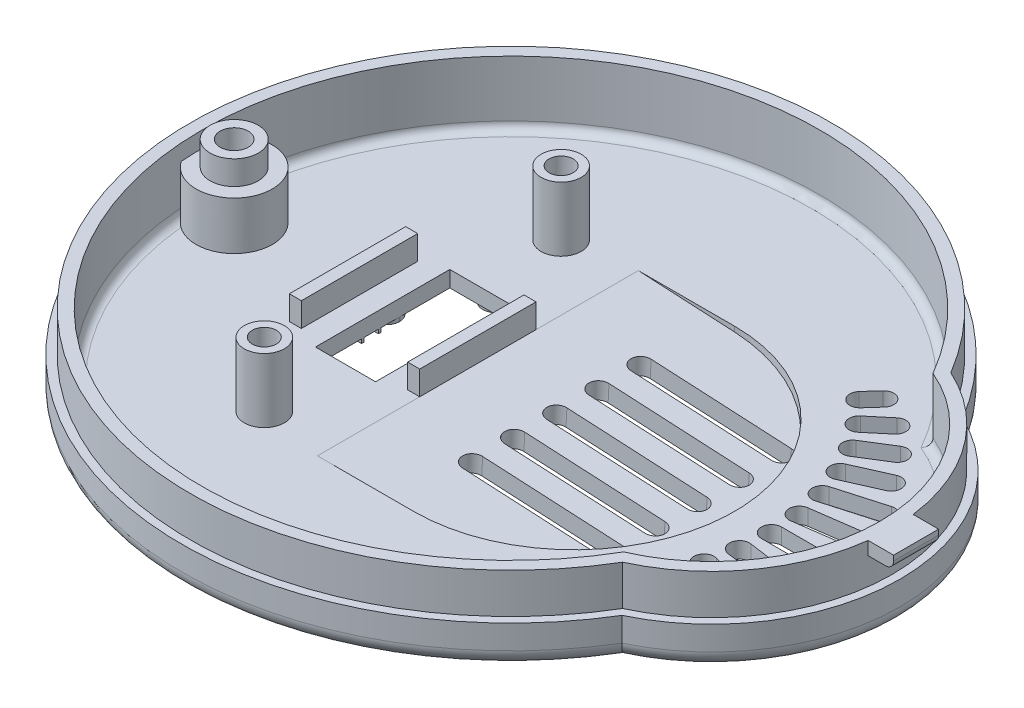
from build123d import *

# Parameters (mm, degrees)
BOSS_EXTRUDE3_DEPTH        = 2
BOSS_EXTRUDE4_DEPTH        = 10
BOSS_EXTRUDE5_DEPTH        = 5
BOSS_EXTRUDE7_START        = -1.65
BOSS_EXTRUDE7_DEPTH        = 1.65
FILLET2_R                  = 1
SKETCH12_W                 = 7.5
SKETCH12_H                 = 16.75
CUT_EXTRUDE1_DEPTH         = 2
SKETCH17_W                 = 1.5
SKETCH17_H                 = 14.5
BOSS_EXTRUDE8_DEPTH        = 3
SKETCH18_R                 = 2.5
SKETCH18_R_2               = 1.5
BOSS_EXTRUDE9_DEPTH        = 8
FILLET3_R                  = 2
FILLET4_R                  = 1
SKETCH20_R                 = 4.75
BOSS_EXTRUDE10_DEPTH       = 6
SKETCH19_R                 = 4
CUT_EXTRUDE2_DEPTH         = 5
SKETCH21_R                 = 3
BOSS_EXTRUDE11_DEPTH       = 3
CUT_EXTRUDE3_DEPTH         = 66.971584871
CUT_EXTRUDE3_DEPTH_BACK    = 66.971584871
SKETCH22_R                 = 1.75
BOSS_EXTRUDE12_OUTLINE_R   = 1.6742555
BOSS_EXTRUDE12_OUTLINE_R_2 = 1.275330366
BOSS_EXTRUDE12_OUTLINE_R_3 = 1.309435817
BOSS_EXTRUDE12_OUTLINE_W   = 3.190146264
BOSS_EXTRUDE12_OUTLINE_H   = 0.307258176
BOSS_EXTRUDE12_DEPTH       = 0.5
BOSS_EXTRUDE13_DEPTH       = 0.5
CUT_REVOLVE1_ANGLE         = 3
REVOLVE1_ANGLE             = 3
CUT_EXTRUDE4_DEPTH         = 67.049620842
FILLET5_R                  = 0.3
CUT_EXTRUDE5_DEPTH         = 66.971584854


# Read off the part's stored shape, not the designer's step: Boss-Extrude12
with BuildPart() as part:
    # Sketch4 → Boss-Extrude3 (new body)
    with BuildSketch(Plane(origin=(0, 0, 0), x_dir=(1, 0, 0), z_dir=(0, 1, 0))):
        with BuildLine():
            ThreePointArc((35.075, 21.230741273), (-41, 0), (35.075, -21.230741273))
            ThreePointArc((35.075, -21.230741273), (48.5, 0), (35.075, 21.230741273))
        make_face()
    extrude(amount=BOSS_EXTRUDE3_DEPTH)

    # Sketch4<5> → Boss-Extrude4 (add)
    with BuildSketch(Plane(origin=(0, 0, 0), x_dir=(1, 0, 0), z_dir=(0, 1, 0))):
        with BuildLine():
            ThreePointArc((34.375, 20.453835215), (-40, 0), (34.375, -20.453835215))
            ThreePointArc((34.375, -20.453835215), (47.5, 0), (34.375, 20.453835215))
        make_face()
        with BuildLine():
            ThreePointArc((33.325, -19.279376935), (46, 0), (33.325, 19.279376935))
            ThreePointArc((33.325, 19.279376935), (-38.5, 0), (33.325, -19.279376935))
        make_face(mode=Mode.SUBTRACT)
    extrude(amount=BOSS_EXTRUDE4_DEPTH)

    # Sketch4<6> → Boss-Extrude5 (add)
    with BuildSketch(Plane(origin=(0, 0, 0), x_dir=(1, 0, 0), z_dir=(0, 1, 0))):
        with BuildLine():
            ThreePointArc((35.075, 21.230741273), (-41, 0), (35.075, -21.230741273))
            ThreePointArc((35.075, -21.230741273), (48.5, 0), (35.075, 21.230741273))
        make_face()
        with BuildLine():
            ThreePointArc((34.375, -20.453835215), (47.5, 0), (34.375, 20.453835215))
            ThreePointArc((34.375, 20.453835215), (-40, 0), (34.375, -20.453835215))
        make_face(mode=Mode.SUBTRACT)
    extrude(amount=BOSS_EXTRUDE5_DEPTH)

    # Sketch11 → Boss-Extrude7 (add)
    with BuildSketch(Plane(origin=(0, 10, 0), x_dir=(1, 0, 0), z_dir=(0, 1, 0)).offset(BOSS_EXTRUDE7_START)):
        with BuildLine():
            ThreePointArc((47.324336307, 2.806066364), (47.5, 0), (47.324336307, -2.806066364))
            Line((47.324336307, -2.806066364), (50.5, -2.806066364))
            Line((50.5, -2.806066364), (50.5, 2.806066364))
            Line((50.5, 2.806066364), (47.324336307, 2.806066364))
        make_face()
    extrude(amount=BOSS_EXTRUDE7_DEPTH)

    # Fillet2
    fillet2_edges = [part.edges().sort_by_distance(p)[0] for p in [
        (50.5, 8.35, 0),
    ]]
    fillet(fillet2_edges, radius=FILLET2_R)

    # Sketch12 → Cut-Extrude1 (cut)
    with BuildSketch(Plane.XZ):
        with Locations((-12.25, 0)):
            Rectangle(SKETCH12_W, SKETCH12_H)
    extrude(amount=-CUT_EXTRUDE1_DEPTH, mode=Mode.SUBTRACT)

    # Sketch17 → Boss-Extrude8 (add)
    with BuildSketch(Plane(origin=(0, 2, 0), x_dir=(1, 0, 0), z_dir=(0, 1, 0))):
        Polygon((-5.625, 0), (-5.625, -7.25), (-4.125, -7.25), (-4.125, 7.25), (-5.625, 7.25), align=None)
        with Locations((-19.625, 0)):
            Rectangle(SKETCH17_W, SKETCH17_H)
    extrude(amount=BOSS_EXTRUDE8_DEPTH)

    # Sketch18 → Boss-Extrude9 (add)
    # profile 1 of 2: a face of its own
    with BuildSketch(Plane(origin=(0, 2, 0), x_dir=(1, 0, 0), z_dir=(0, 1, 0))):
        with Locations(Location((-12.25, -18.5, 0), (0, 0, 270))):
            Circle(SKETCH18_R)
        with Locations(Location((-12.25, -18.5, 0), (0, 0, 270))):
            Circle(SKETCH18_R_2, mode=Mode.SUBTRACT)
    # profile 2 of 2: a face of its own
    with BuildSketch(Plane(origin=(0, 2, 0), x_dir=(1, 0, 0), z_dir=(0, 1, 0))):
        with Locations(Location((-12.25, 18.5, 0), (0, 0, 270))):
            Circle(SKETCH18_R)
        with Locations(Location((-12.25, 18.5, 0), (0, 0, 270))):
            Circle(SKETCH18_R_2, mode=Mode.SUBTRACT)
    extrude(amount=BOSS_EXTRUDE9_DEPTH)

    # Fillet3
    fillet3_edges = [part.edges().sort_by_distance(p)[0] for p in [
        (48.5, 0, 0),
        (-41, 0, 0),
    ]]
    fillet(fillet3_edges, radius=FILLET3_R)

    # Fillet4
    fillet4_edges = [part.edges().sort_by_distance(p)[0] for p in [
        (46, 2, 0),
        (-38.5, 2, 0),
    ]]
    fillet(fillet4_edges, radius=FILLET4_R)

    # Sketch20 → Boss-Extrude10 (add)
    with BuildSketch(Plane(origin=(0, 2, 0), x_dir=(1, 0, 0), z_dir=(0, 1, 0))):
        with Locations((-34.5, 0)):
            Circle(SKETCH20_R)
    extrude(amount=BOSS_EXTRUDE10_DEPTH)

    # Sketch19 → Cut-Extrude2 (cut)
    with BuildSketch(Plane.XZ):
        with Locations(Location((-34.5, 0, 0), (0, 0, 270))):
            Circle(SKETCH19_R)
    extrude(amount=-CUT_EXTRUDE2_DEPTH, mode=Mode.SUBTRACT)

    # Sketch21 → Boss-Extrude11 (add)
    with BuildSketch(Plane(origin=(0, 8, 0), x_dir=(1, 0, 0), z_dir=(0, 1, 0))):
        with Locations(Location((-34.5, 0, 0), (0, 0, 270))):
            Circle(SKETCH21_R)
    extrude(amount=BOSS_EXTRUDE11_DEPTH)

    # Sketch22 → Cut-Extrude3 (cut, two sides: drawn at the far end of the back side and taken through both)
    with BuildSketch(Plane(origin=(0, 11, 0), x_dir=(1, 0, 0), z_dir=(0, 1, 0)).offset(-CUT_EXTRUDE3_DEPTH_BACK)):
        with Locations(Location((-34.5, 0, 0), (0, 0, 270))):
            Circle(SKETCH22_R)
    extrude(amount=CUT_EXTRUDE3_DEPTH + CUT_EXTRUDE3_DEPTH_BACK, mode=Mode.SUBTRACT)

    # Boss-Extrude12 outline → Boss-Extrude12 (add)
    # profile 1 of 7: a face of its own
    with BuildSketch(Plane.XZ):
        with Locations((-12.125287321, -10.272169908)):
            Circle(BOSS_EXTRUDE12_OUTLINE_R)
        with Locations((-12.125287321, -10.272169908)):
            Circle(BOSS_EXTRUDE12_OUTLINE_R_2, mode=Mode.SUBTRACT)
    # profile 2 of 7: a face of its own
    with BuildSketch(Plane.XZ):
        Polygon((-17.578397289, 0.525371169), (-17.578397289, 1.743381476), (-17.834807781, 1.743381476), (-17.834807781, 0.525371169), (-18.844865109, 0.525371169), (-18.844865109, 1.743381476), (-19.156794578, 1.743381476), (-19.156794578, 0.228295484), (-16, 0.228295484), (-16, 0.525371169), align=None)
    # profile 3 of 7: a face of its own
    with BuildSketch(Plane.XZ):
        Polygon((-19.156794578, 2.322679061), (-16, 2.322679061), (-16, 2.63460853), (-17.578397289, 2.63460853), (-17.578397289, 3.912033974), (-17.834807781, 3.912033974), (-17.834807781, 2.63460853), (-18.844865109, 2.63460853), (-18.844865109, 3.912033974), (-19.156794578, 3.912033974), align=None)
    # profile 4 of 7: a face of its own
    with BuildSketch(Plane.XZ):
        with BuildLine():
            Line((-16, -2.176607424), (-16, -2.057455601))
            ThreePointArc((-16, -2.057455601), (-19.223307936, -2.117031513), (-16, -2.176607424))
        make_face()
        with Locations((-17.611103402, -2.117031512)):
            Circle(BOSS_EXTRUDE12_OUTLINE_R_3, mode=Mode.SUBTRACT)
    # profile 5 of 7: a face of its own
    with BuildSketch(Plane.XZ):
        Polygon((-12.125287321, 10.68730022), (-10.621169687, 10.68730022), (-10.621169687, 10.990258489), (-13.811315951, 10.990258489), (-13.811315951, 10.68730022), (-12.494106084, 10.68730022), (-12.494106084, 9.093476282), (-13.811315951, 9.093476282), (-13.811315951, 8.790518012), (-10.621169687, 8.790518012), (-10.621169687, 9.093476282), (-12.125287321, 9.093476282), align=None)
    # profile 6 of 7: a face of its own
    with BuildSketch(Plane.XZ):
        with Locations((-12.216242819, 11.941385561)):
            Rectangle(BOSS_EXTRUDE12_OUTLINE_W, BOSS_EXTRUDE12_OUTLINE_H)
    # profile 7 of 7: a face of its own
    with BuildSketch(Plane.XZ):
        Polygon((-13.617145042, -13.560432207), (-10.471278325, -13.560432207), (-10.471278325, -12.065776469), (-10.761683334, -12.065776469), (-10.761683334, -13.25927023), (-13.617145042, -13.25927023), align=None)
    extrude(amount=BOSS_EXTRUDE12_DEPTH)

    # Sketch23 → Boss-Extrude13 (add)
    with BuildSketch(Plane.XZ):
        with BuildLine():
            Line((-2.25, 14.5), (-12.25, 14.5))
            Line((-12.25, 14.5), (-12.75, 14.5))
            Line((-12.75, 14.5), (-22.25, 14.5))
            add(Edge.make_bspline(
                [(-22.25, -14.5), (-28.25, 0), (-22.25, 14.5)],
                knots=[0, 0, 0, 1, 1, 1], degree=2))
            Line((-22.25, -14.5), (-12.25, -14.5))
            Line((-12.25, -14.5), (-2.25, -14.5))
            add(Edge.make_bspline(
                [(-2.25, -14.5), (3.75, 0), (-2.25, 14.5)],
                knots=[0, 0, 0, 1, 1, 1], degree=2))
        make_face()
        with BuildLine():
            Line((-21.914404484, 14), (-12.75, 14))
            Line((-12.75, 14), (-12.25, 14))
            Line((-12.25, 14), (-2.585595516, 14))
            add(Edge.make_bspline(
                [(-2.585595516, 14), (3.085595516, 0), (-2.585595516, -14)],
                knots=[0.010770928, 0.010770928, 0.010770928, 0.989229072, 0.989229072, 0.989229072], degree=2))
            Line((-2.585595516, -14), (-12.25, -14))
            Line((-12.25, -14), (-21.914404484, -14))
            add(Edge.make_bspline(
                [(-21.914404484, -14), (-27.585595516, 0), (-21.914404484, 14)],
                knots=[0.010770928, 0.010770928, 0.010770928, 0.989229072, 0.989229072, 0.989229072], degree=2))
        make_face(mode=Mode.SUBTRACT)
    extrude(amount=BOSS_EXTRUDE13_DEPTH)

    # Sketch24 → Cut-Revolve1 (revolve, cut)
    with BuildSketch(Plane(origin=(0, 2, 0), x_dir=(1, 0, 0), z_dir=(0, 1, 0))):
        with BuildLine():
            Line((7.875, 20), (7.875, 0))
            Line((7.875, 0), (7.875, -20))
            ThreePointArc((7.875, -20), (22.017135624, -14.142135624), (27.875, 0))
            ThreePointArc((27.875, 0), (22.017135624, 14.142135624), (7.875, 20))
        make_face()
        with BuildLine():
            Line((-4.125, 7.25), (-4.125, 0))
            Line((-4.125, 0), (7.875, 0))
            Line((7.875, 0), (7.875, 20))
            ThreePointArc((7.875, 20), (1.55044468, 18.973665961), (-4.125, 16))
            Line((-4.125, 16), (-4.125, 7.25))
        make_face()
        with BuildLine():
            Line((7.875, 0), (-4.125, 0))
            Line((-4.125, 0), (-4.125, -7.25))
            Line((-4.125, -7.25), (-4.125, -16))
            ThreePointArc((-4.125, -16), (1.55044468, -18.973665961), (7.875, -20))
            Line((7.875, -20), (7.875, 0))
        make_face()
        with BuildLine():
            Line((-4.125, -20), (7.875, -20))
            ThreePointArc((7.875, -20), (1.55044468, -18.973665961), (-4.125, -16))
            Line((-4.125, -16), (-4.125, -20))
        make_face()
        with BuildLine():
            ThreePointArc((-4.125, 16), (1.55044468, 18.973665961), (7.875, 20))
            Line((7.875, 20), (-4.125, 20))
            Line((-4.125, 20), (-4.125, 16))
        make_face()
    revolve(axis=Axis((-4.125, 2, -20), (0, 0, -1)), revolution_arc=CUT_REVOLVE1_ANGLE, mode=Mode.SUBTRACT)

    # Sketch25 → Revolve1 (revolve)
    with BuildSketch(Plane.XZ):
        with BuildLine():
            Line((-7.124895394, 14.5), (-2.25, 14.5))
            add(Edge.make_bspline(
                [(-2.25, -14.5), (3.75, 0), (-2.25, 14.5)],
                knots=[0, 0, 0, 1, 1, 1], degree=2))
            Line((-2.25, -14.5), (-7.124895394, -14.5))
            Line((-7.124895394, -14.5), (-7.124895394, -21.75))
            Line((-7.124895394, -21.75), (7.875104606, -21.75))
            ThreePointArc((7.875104606, -21.75), (29.625104606, 0), (7.875104606, 21.75))
            Line((7.875104606, 21.75), (-7.124895394, 21.75))
            Line((-7.124895394, 21.75), (-7.124895394, 14.5))
        make_face()
    revolve(axis=Axis((-7.124895394, 0, 21.75), (0, 0, -1)), revolution_arc=REVOLVE1_ANGLE)

    # Sketch26 → Cut-Extrude4 (cut, through all)
    with BuildSketch(Plane(origin=(-0.019515461, -0.372377183, 0), x_dir=(0.9986295347545739, -0.05233595624294397, 0), z_dir=(-0.05233595624294398, -0.998629534754574, 0))):
        with BuildLine():
            Line((5.634869027, 9.25), (14.384869027, 9.25))
            Line((14.384869027, 9.25), (23.134869027, 9.25))
            ThreePointArc((23.134869027, 9.25), (24.384869027, 10.5), (23.134869027, 11.75))
            Line((23.134869027, 11.75), (5.634869027, 11.75))
            ThreePointArc((5.634869027, 11.75), (4.384869027, 10.5), (5.634869027, 9.25))
        make_face()
        with BuildLine():
            Line((5.634869027, 4), (23.134869027, 4))
            ThreePointArc((23.134869027, 4), (24.384869027, 5.25), (23.134869027, 6.5))
            Line((23.134869027, 6.5), (5.634869027, 6.5))
            ThreePointArc((5.634869027, 6.5), (4.384869027, 5.25), (5.634869027, 4))
        make_face()
        with BuildLine():
            Line((23.134869027, -9.25), (14.384869027, -9.25))
            Line((14.384869027, -9.25), (5.634869027, -9.25))
            ThreePointArc((5.634869027, -9.25), (4.384869027, -10.5), (5.634869027, -11.75))
            Line((5.634869027, -11.75), (23.134869027, -11.75))
            ThreePointArc((23.134869027, -11.75), (24.384869027, -10.5), (23.134869027, -9.25))
        make_face()
        with BuildLine():
            Line((23.134869027, -4), (5.634869027, -4))
            ThreePointArc((5.634869027, -4), (4.384869027, -5.25), (5.634869027, -6.5))
            Line((5.634869027, -6.5), (23.134869027, -6.5))
            ThreePointArc((23.134869027, -6.5), (24.384869027, -5.25), (23.134869027, -4))
        make_face()
        with BuildLine():
            ThreePointArc((5.634869027, 1.25), (4.384869027, 0), (5.634869027, -1.25))
            Line((5.634869027, -1.25), (23.134869027, -1.25))
            ThreePointArc((23.134869027, -1.25), (24.384869027, 0), (23.134869027, 1.25))
            Line((23.134869027, 1.25), (5.634869027, 1.25))
        make_face()
    extrude(amount=-CUT_EXTRUDE4_DEPTH, mode=Mode.SUBTRACT)

    # Fillet5
    fillet5_edges = [part.edges().sort_by_distance(p)[0] for p in [
        (29.574740008, -1.923346392, 0),
        (0.364826116, -0.392519672, 21.75),
        (0.364826116, -0.392519672, -21.75),
    ]]
    fillet(fillet5_edges, radius=FILLET5_R)
    fillet5_2_edges = [part.edges().sort_by_distance(p)[0] for p in [
        (-7.124895394, 0, -17.975),
        (-7.124895394, 0, 17.975),
        (29.625104606, 0, 0),
        (3.241202997, 0, 21.75),
        (3.241202997, 0, -21.75),
        (-4.669967821, 0, -21.696132539),
        (-4.669967821, 0, 21.696132539),
    ]]
    fillet(fillet5_2_edges, radius=FILLET5_R)

    # Sketch28 → Cut-Extrude5 (cut, through all)
    with BuildSketch(Plane.XZ):
        with BuildLine():
            Line((32.470376507, 1.25), (41.401582949, 1.25))
            ThreePointArc((41.401582949, 1.25), (42.651582949, 0), (41.401582949, -1.25))
            Line((41.401582949, -1.25), (32.470376507, -1.25))
            ThreePointArc((32.470376507, -1.25), (31.220376507, 0), (32.470376507, 1.25))
        make_face()
        with BuildLine():
            Line((32.03608097, 4.960715537), (39.402117048, 5.995944395))
            ThreePointArc((39.402117048, 5.995944395), (40.81391851, 4.932075686), (39.750049801, 3.520274224))
            Line((39.750049801, 3.520274224), (32.384013722, 2.485045365))
            ThreePointArc((32.384013722, 2.485045365), (30.97221226, 3.548914074), (32.03608097, 4.960715537))
        make_face()
        with BuildLine():
            Line((31.089580179, 8.574876388), (37.144914076, 10.311215442))
            ThreePointArc((37.144914076, 10.311215442), (38.691037891, 9.454185017), (37.834007465, 7.908061202))
            Line((37.834007465, 7.908061202), (31.778673568, 6.171722148))
            ThreePointArc((31.778673568, 6.171722148), (30.232549754, 7.028752573), (31.089580179, 8.574876388))
        make_face()
        with BuildLine():
            Line((29.649296695, 12.022137024), (34.04824805, 13.980676353))
            ThreePointArc((34.04824805, 13.980676353), (35.698600676, 13.347165334), (35.065089658, 11.696812709))
            Line((35.065089658, 11.696812709), (30.666138303, 9.73827338))
            ThreePointArc((30.666138303, 9.73827338), (29.015785677, 10.371784398), (29.649296695, 12.022137024))
        make_face()
        with BuildLine():
            Line((27.743263999, 15.235400438), (31.171704133, 17.377727603))
            ThreePointArc((31.171704133, 17.377727603), (32.894163334, 16.980066563), (32.496502294, 15.257607363))
            Line((32.496502294, 15.257607363), (29.06806216, 13.115280198))
            ThreePointArc((29.06806216, 13.115280198), (27.345602959, 13.512941238), (27.743263999, 15.235400438))
        make_face()
        with BuildLine():
            Line((25.408580849, 18.152124113), (27.883790067, 20.229071255))
            ThreePointArc((27.883790067, 20.229071255), (29.644830133, 20.075000213), (29.490759091, 18.313960147))
            Line((29.490759091, 18.313960147), (27.015549873, 16.237013005))
            ThreePointArc((27.015549873, 16.237013005), (25.254509807, 16.391084047), (25.408580849, 18.152124113))
        make_face()
        with BuildLine():
            Line((22.690689196, 20.715537339), (24.095387424, 22.275612772))
            ThreePointArc((24.095387424, 22.275612772), (25.860731714, 22.368130546), (25.953249488, 20.602786256))
            Line((25.953249488, 20.602786256), (24.548551259, 19.042710824))
            ThreePointArc((24.548551259, 19.042710824), (22.783206969, 18.95019305), (22.690689196, 20.715537339))
        make_face()
        with BuildLine():
            Line((32.384013722, -2.485045365), (39.750049801, -3.520274224))
            ThreePointArc((39.750049801, -3.520274224), (40.81391851, -4.932075686), (39.402117048, -5.995944395))
            Line((39.402117048, -5.995944395), (32.03608097, -4.960715537))
            ThreePointArc((32.03608097, -4.960715537), (30.97221226, -3.548914074), (32.384013722, -2.485045365))
        make_face()
        with BuildLine():
            Line((31.778673568, -6.171722148), (37.834007465, -7.908061202))
            ThreePointArc((37.834007465, -7.908061202), (38.691037891, -9.454185017), (37.144914076, -10.311215442))
            Line((37.144914076, -10.311215442), (31.089580179, -8.574876388))
            ThreePointArc((31.089580179, -8.574876388), (30.232549754, -7.028752573), (31.778673568, -6.171722148))
        make_face()
        with BuildLine():
            Line((30.666138303, -9.73827338), (35.065089658, -11.696812709))
            ThreePointArc((35.065089658, -11.696812709), (35.698600676, -13.347165334), (34.04824805, -13.980676353))
            Line((34.04824805, -13.980676353), (29.649296695, -12.022137024))
            ThreePointArc((29.649296695, -12.022137024), (29.015785677, -10.371784398), (30.666138303, -9.73827338))
        make_face()
        with BuildLine():
            Line((29.06806216, -13.115280198), (32.496502294, -15.257607363))
            ThreePointArc((32.496502294, -15.257607363), (32.894163334, -16.980066563), (31.171704133, -17.377727603))
            Line((31.171704133, -17.377727603), (27.743263999, -15.235400438))
            ThreePointArc((27.743263999, -15.235400438), (27.345602959, -13.512941238), (29.06806216, -13.115280198))
        make_face()
        with BuildLine():
            Line((27.015549873, -16.237013005), (29.490759091, -18.313960147))
            ThreePointArc((29.490759091, -18.313960147), (29.644830133, -20.075000213), (27.883790067, -20.229071255))
            Line((27.883790067, -20.229071255), (25.408580849, -18.152124113))
            ThreePointArc((25.408580849, -18.152124113), (25.254509807, -16.391084047), (27.015549873, -16.237013005))
        make_face()
        with BuildLine():
            Line((24.548551259, -19.042710824), (25.953249488, -20.602786256))
            ThreePointArc((25.953249488, -20.602786256), (25.860731714, -22.368130546), (24.095387424, -22.275612772))
            Line((24.095387424, -22.275612772), (22.690689196, -20.715537339))
            ThreePointArc((22.690689196, -20.715537339), (22.783206969, -18.95019305), (24.548551259, -19.042710824))
        make_face()
    extrude(amount=-CUT_EXTRUDE5_DEPTH, mode=Mode.SUBTRACT)


solid = part.part
